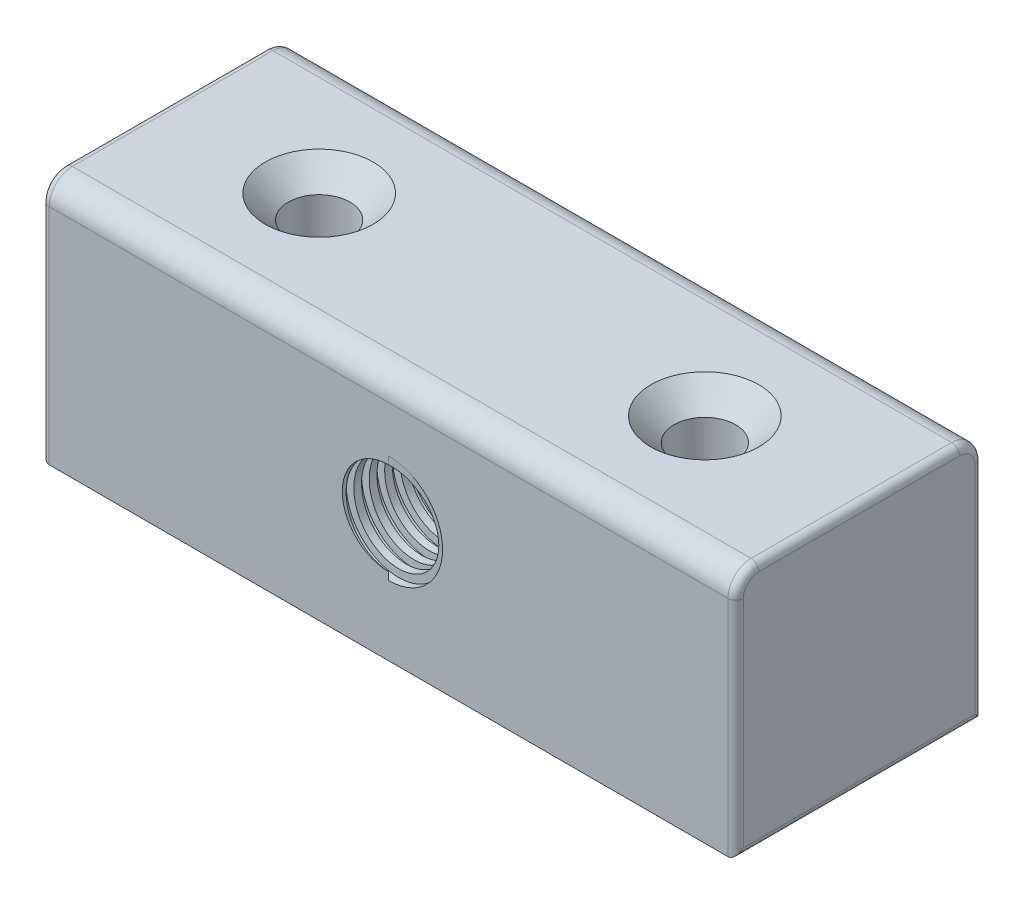
from build123d import *
from OCP.BRepFilletAPI import BRepFilletAPI_MakeFillet

# Parameters (mm, degrees)
SKETCH2_W              = 90
SKETCH2_H              = 32
BOSS_EXTRUDE1_DEPTH    = 16
F_8_0MM_DOWEL_HOLE1_D  = 8
CHAMFER1_SIZE          = 3
F_12_0MM_DOWEL_HOLE1_D = 12
CUT_SWEEP1_PITCH       = 2
FILLET1_R1             = 1
FILLET1_R2             = 3


with BuildPart() as part:
    # Sketch2 → Boss-Extrude1 (new, symmetric)
    with BuildSketch(Plane(origin=(0, 0, 0), x_dir=(1, 0, 0), z_dir=(0, 1, 0))):
        Rectangle(SKETCH2_W, SKETCH2_H)
    extrude(amount=BOSS_EXTRUDE1_DEPTH, both=True)

    # Ø8.0mm Dowel Hole1 (through all)
    with Locations(Plane(origin=(0, 16, 0), x_dir=(1, 0, 0), z_dir=(0, 1, 0))):
        with Locations((-25, 0), (25, 0)):
            Hole(F_8_0MM_DOWEL_HOLE1_D / 2)

    # Chamfer1
    chamfer1_edges = [part.edges().sort_by_distance(p)[0] for p in [
        (29, 16, 0),
        (-21, 16, 0),
    ]]
    chamfer(chamfer1_edges, length=CHAMFER1_SIZE)

    # Ø12.0mm Dowel Hole1 (through all)
    with Locations(Plane.XY.offset(16)):
        with Locations((0, 0)):
            Hole(F_12_0MM_DOWEL_HOLE1_D / 2)

    # Cut-Sweep1: arcs per turn and ends read off the stored shape
    # Cut-Sweep1: the profile of Sketch9 screwed along a right-hand helix through 17.6 turns, 10 arcs to a turn; built about Z, then put on its axis
    cut_sweep1_z = Axis((0, 0, 0), (0, 0, 1))
    cut_sweep1_corners = [(7.000300393, -0.008834531, -1.500702167), (5.000611464, -0.044107552, -1.500702167), (4.999677132, 0.008861357, -2.499297892), (6.999366061, 0.044134378, -2.499297892)]
    with BuildLine(mode=Mode.PRIVATE) as cut_sweep1_profile:
        Line(cut_sweep1_corners[0], cut_sweep1_corners[1])
        Line(cut_sweep1_corners[1], cut_sweep1_corners[2])
        Line(cut_sweep1_corners[2], cut_sweep1_corners[3])
        Line(cut_sweep1_corners[3], cut_sweep1_corners[0])
    cut_sweep1_cap = Face(cut_sweep1_profile.wire())
    cut_sweep1_turn_angles = [0, 18, 36, 54, 72, 90, 108, 126, 144, 162, 180, 198, 216, 234, 252, 270, 288, 306, 324, 342, 360]
    cut_sweep1_turn_weights = [1, 0.9510565162951535, 1, 0.9510565162951535, 1, 0.9510565162951535, 1, 0.9510565162951535, 1, 0.9510565162951535, 1, 0.9510565162951535, 1, 0.9510565162951535, 1, 0.9510565162951535, 1, 0.9510565162951535, 1, 0.9510565162951535, 1]
    cut_sweep1_turn_rails = [Edge.make_bspline([Vector(p[0], p[1], 0).rotate(cut_sweep1_z, cut_sweep1_turn_angles[k]) / cut_sweep1_turn_weights[k] + Vector(0, 0, p[2] + CUT_SWEEP1_PITCH * cut_sweep1_turn_angles[k] / 360) for k in range(21)], [0, 0, 0, 1, 1, 2, 2, 3, 3, 4, 4, 5, 5, 6, 6, 7, 7, 8, 8, 9, 9, 10, 10, 10], 2, cut_sweep1_turn_weights) for p in cut_sweep1_corners]
    cut_sweep1_turn_sides = [Face.make_surface_from_curves(cut_sweep1_turn_rails[p[0]], cut_sweep1_turn_rails[p[1]]) for p in [(0, 1), (1, 2), (2, 3), (3, 0)]]
    cut_sweep1_last_angles = [6120, 6138, 6156, 6174, 6192, 6210, 6228, 6246, 6264, 6282, 6300, 6318, 6336]
    cut_sweep1_last_weights = [1, 0.9510565162951535, 1, 0.9510565162951535, 1, 0.9510565162951535, 1, 0.9510565162951535, 1, 0.9510565162951535, 1, 0.9510565162951535, 1]
    cut_sweep1_last_rails = [Edge.make_bspline([Vector(p[0], p[1], 0).rotate(cut_sweep1_z, cut_sweep1_last_angles[k]) / cut_sweep1_last_weights[k] + Vector(0, 0, p[2] + CUT_SWEEP1_PITCH * cut_sweep1_last_angles[k] / 360) for k in range(13)], [0, 0, 0, 1, 1, 2, 2, 3, 3, 4, 4, 5, 5, 6, 6, 6], 2, cut_sweep1_last_weights) for p in cut_sweep1_corners]
    cut_sweep1_last_sides = [Face.make_surface_from_curves(cut_sweep1_last_rails[p[0]], cut_sweep1_last_rails[p[1]]) for p in [(0, 1), (1, 2), (2, 3), (3, 0)]]
    cut_sweep1 = Plane(origin=(0, 0, 16), x_dir=(1, 0, 0), z_dir=(0, 0, -1)) * Solid(Shell([*[p.moved(Location((0, 0, CUT_SWEEP1_PITCH * i))) for i in range(17) for p in cut_sweep1_turn_sides], *cut_sweep1_last_sides, cut_sweep1_cap, cut_sweep1_cap.rotate(cut_sweep1_z, 6336).moved(Location((0, 0, CUT_SWEEP1_PITCH * 6336 / 360)))]))
    add(cut_sweep1, mode=Mode.SUBTRACT)

    # Fillet1: one fillet with a radius per group of edges: ONE call of the kernel's fillet builder (fillet() takes one radius for all edges)
    fillet1_edges_1 = [part.edges().sort_by_distance(p)[0] for p in [
        (-45, -16, 0),
        (-45, 0, 16),
        (-45, 0, -16),
        (-45, 16, 0),
        (45, -16, 0),
        (45, 0, 16),
        (45, 0, -16),
        (45, 16, 0),
    ]]
    fillet1_edges_2 = [part.edges().sort_by_distance(p)[0] for p in [
        (0, 16, 16),
        (0, 16, -16),
    ]]
    fillet1 = BRepFilletAPI_MakeFillet(part.part.solid().wrapped)
    for e in fillet1_edges_1:
        fillet1.Add(FILLET1_R1, e.wrapped)
    for e in fillet1_edges_2:
        fillet1.Add(FILLET1_R2, e.wrapped)
    add(Compound.cast(fillet1.Shape()), mode=Mode.REPLACE)


solid = part.part
